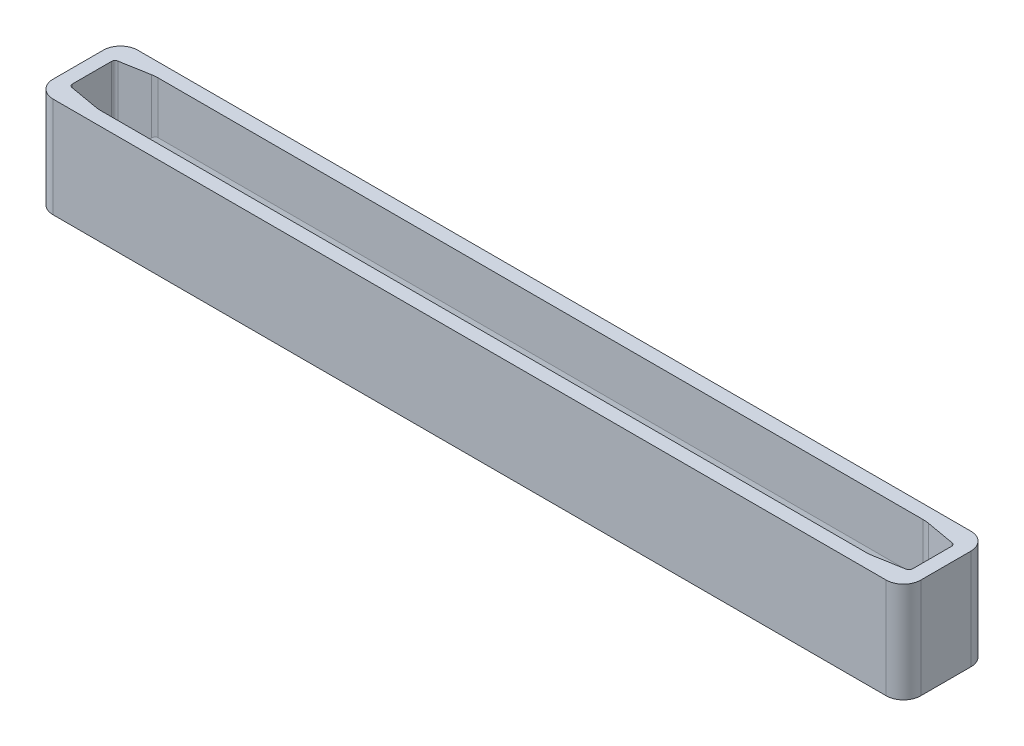
from build123d import *
from OCP.BRepFilletAPI import BRepFilletAPI_MakeChamfer

# Parameters (mm, degrees)
SKETCH1_W           = 251
SKETCH1_H           = 24.5
SKETCH1_W_2         = 243
SKETCH1_H_2         = 16.5
BOSS_EXTRUDE1_DEPTH = 25
SKETCH1_2_W         = 251
SKETCH1_2_H         = 24.5
BOSS_EXTRUDE2_DEPTH = 4
CHAMFER1_SIZE       = 10
CHAMFER1_SIZE2      = 1.763269807
FILLET1_R           = 10
FILLET2_R           = 1
FILLET4_R           = 10
FILLET5_R           = 5


with BuildPart() as part:
    # Sketch1 → Boss-Extrude1 (new body)
    with BuildSketch(Plane(origin=(0, 0, 0), x_dir=(1, 0, 0), z_dir=(0, 1, 0))):
        Rectangle(SKETCH1_W, SKETCH1_H)
        Rectangle(SKETCH1_W_2, SKETCH1_H_2, mode=Mode.SUBTRACT)
    extrude(amount=BOSS_EXTRUDE1_DEPTH)

    # Sketch1<2> → Boss-Extrude2 (add)
    with BuildSketch(Plane(origin=(0, 0, 0), x_dir=(1, 0, 0), z_dir=(0, 1, 0))):
        Rectangle(SKETCH1_2_W, SKETCH1_2_H)
    extrude(amount=-BOSS_EXTRUDE2_DEPTH)

    # Chamfer1: one chamfer whose edges measure the first distance from different faces: ONE call of the kernel's chamfer builder (chamfer() names one face for all edges)
    chamfer1_edges_1 = [part.edges().sort_by_distance(p)[0] for p in [
        (121.5, 12.5, 8.25),
        (0, 0, 8.25),
        (-121.5, 12.5, 8.25),
    ]]
    chamfer1_side_1 = [part.faces().sort_by_distance(p)[0] for p in [
        (0, 12.5, 8.25),
    ]]
    chamfer1_edges_2 = [part.edges().sort_by_distance(p)[0] for p in [
        (0, 0, -8.25),
        (121.5, 12.5, -8.25),
        (-121.5, 12.5, -8.25),
    ]]
    chamfer1_side_2 = [part.faces().sort_by_distance(p)[0] for p in [
        (0, 12.5, -8.25),
    ]]
    chamfer1 = BRepFilletAPI_MakeChamfer(part.part.solid().wrapped)
    for e in chamfer1_edges_1:
        chamfer1.Add(CHAMFER1_SIZE, CHAMFER1_SIZE2, e.wrapped, chamfer1_side_1[0].wrapped)  # the first distance lies on this face
    for e in chamfer1_edges_2:
        chamfer1.Add(CHAMFER1_SIZE, CHAMFER1_SIZE2, e.wrapped, chamfer1_side_2[0].wrapped)  # the first distance lies on this face
    add(Compound.cast(chamfer1.Shape()), mode=Mode.REPLACE)

    # Fillet1
    fillet1_edges = [part.edges().sort_by_distance(p)[0] for p in [
        (-111.5, 17.5, 8.25),
        (111.5, 17.5, 8.25),
        (111.5, 17.5, -8.25),
        (-111.5, 17.5, -8.25),
    ]]
    fillet(fillet1_edges, radius=FILLET1_R)

    # Fillet2
    fillet2_edges = [part.edges().sort_by_distance(p)[0] for p in [
        (121.5, 12.5, -6.486730193),
        (121.5, 12.5, 6.486730193),
        (-121.5, 12.5, -6.486730193),
        (-121.5, 12.5, 6.486730193),
    ]]
    fillet(fillet2_edges, radius=FILLET2_R)

    # Fillet4
    # the kernel refuses this fillet: 10 mm, written as the material it adds along each edge
    with BuildSketch(Plane(origin=(-121.5, 0, -30.647630562), x_dir=(0, 1, 0), z_dir=(0, 0, 1))) as fillet4_piece_1_section:
        with BuildLine():
            CenterArc((FILLET4_R, -FILLET4_R), FILLET4_R, 90, 90)
            Line((0, -FILLET4_R), (0, 0))
            Line((0, 0), (FILLET4_R, 0))
        make_face()
    fillet4_piece_1 = extrude(amount=61.295261123, mode=Mode.PRIVATE)
    fillet4_piece_1 = split(fillet4_piece_1, bisect_by=Plane(origin=(-119.266320611, 1.057029519, 6.673113017), z_dir=(0, 0.17364817766693139, -0.9848077530122079)), keep=Keep.TOP, mode=Mode.PRIVATE)
    fillet4_piece_1 = split(fillet4_piece_1, bisect_by=Plane(origin=(-119.266320611, 1.057029519, -6.673113017), z_dir=(0, 0.17364817766693139, 0.9848077530122079)), keep=Keep.TOP, mode=Mode.PRIVATE)
    add(fillet4_piece_1)
    with BuildSketch(Plane(origin=(121.5, 0, 30.647630562), x_dir=(0, 1, 0), z_dir=(0, 0, -1))) as fillet4_piece_2_section:
        with BuildLine():
            CenterArc((FILLET4_R, -FILLET4_R), FILLET4_R, 90, 90)
            Line((0, -FILLET4_R), (0, 0))
            Line((0, 0), (FILLET4_R, 0))
        make_face()
    fillet4_piece_2 = extrude(amount=61.295261123, mode=Mode.PRIVATE)
    fillet4_piece_2 = split(fillet4_piece_2, bisect_by=Plane(origin=(119.266320611, 1.057029519, 6.673113017), z_dir=(0, 0.17364817766693139, -0.9848077530122079)), keep=Keep.TOP, mode=Mode.PRIVATE)
    fillet4_piece_2 = split(fillet4_piece_2, bisect_by=Plane(origin=(119.266320611, 1.057029519, -6.673113017), z_dir=(0, 0.17364817766693139, 0.9848077530122079)), keep=Keep.TOP, mode=Mode.PRIVATE)
    add(fillet4_piece_2)

    # Fillet5
    fillet5_edges = [part.edges().sort_by_distance(p)[0] for p in [
        (-125.5, 10.5, -12.25),
        (125.5, 10.5, -12.25),
        (125.5, 10.5, 12.25),
        (-125.5, 10.5, 12.25),
    ]]
    fillet(fillet5_edges, radius=FILLET5_R)


solid = part.part
